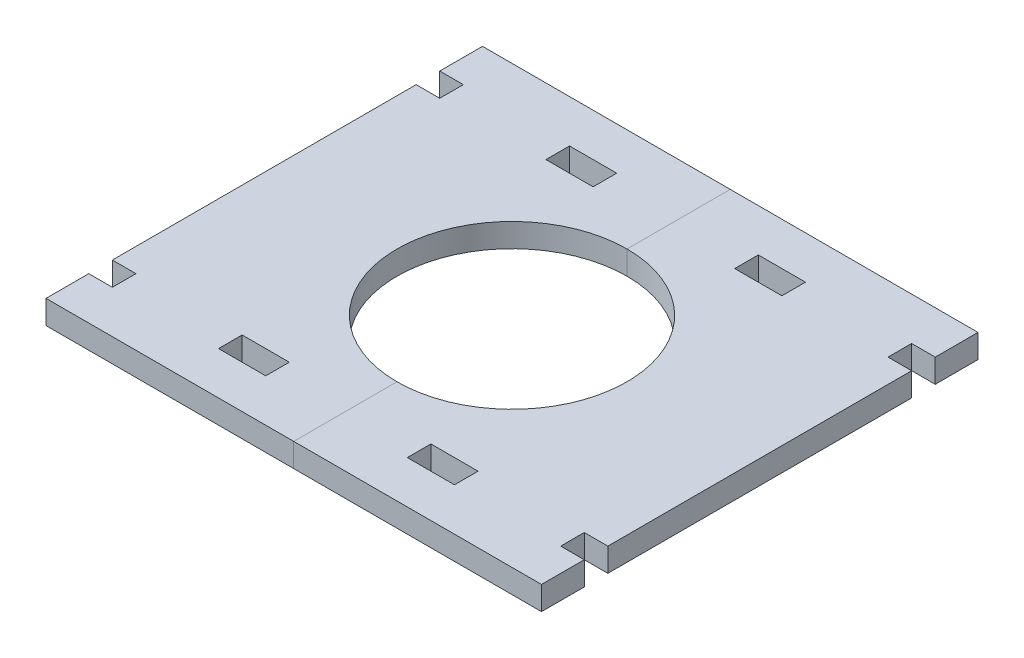
from build123d import *

# Parameters (mm, degrees)
SKETCH2_W               = 84
SKETCH2_H               = 74
SKETCH2_R               = 19.5
BOSS_EXTRUDE1_DEPTH     = 4
CUT_EXTRUDE2_DEPTH      = 57.115951386
CUT_EXTRUDE2_DEPTH_BACK = 57.115951386
SKETCH4_W               = 8
SKETCH4_H               = 4
SKETCH4_W_2             = 4


with BuildPart() as part:
    # Sketch2 → Boss-Extrude1 (new body)
    with BuildSketch(Plane(origin=(0, 0, 0), x_dir=(1, 0, 0), z_dir=(0, 1, 0))):
        Rectangle(SKETCH2_W, SKETCH2_H)
        Circle(SKETCH2_R, mode=Mode.SUBTRACT)
    extrude(amount=BOSS_EXTRUDE1_DEPTH)


with BuildPart() as body_2:
    # Split1: the piece on the far side of the plane
    add(part.part)
    split(bisect_by=Plane(origin=(0, 0, 0), x_dir=(0, 0, 1), z_dir=(1, 0, 0)), keep=Keep.BOTTOM)


with BuildPart() as part_1:
    add(part.part)

    # Split1
    split(bisect_by=Plane(origin=(0, 0, 0), x_dir=(0, 0, 1), z_dir=(1, 0, 0)), keep=Keep.TOP)


with BuildPart() as cut_extrude2_tool:
    # Sketch4 → Cut-Extrude2 (new, two sides: drawn at the far end of the back side and taken through both)
    with BuildSketch(Plane(origin=(0, 4, 0), x_dir=(1, 0, 0), z_dir=(0, 1, 0)).offset(-CUT_EXTRUDE2_DEPTH_BACK)):
        with Locations((-16, -27.75)):
            Rectangle(SKETCH4_W, SKETCH4_H)
        with Locations((-40, -27.75)):
            Rectangle(SKETCH4_W_2, SKETCH4_H)
        with Locations((40, -27.75)):
            Rectangle(SKETCH4_W_2, SKETCH4_H)
        with Locations((16, -27.75)):
            Rectangle(SKETCH4_W, SKETCH4_H)
        with Locations((16, 27.75)):
            Rectangle(SKETCH4_W, SKETCH4_H)
        with Locations((40, 27.75)):
            Rectangle(SKETCH4_W_2, SKETCH4_H)
        with Locations((-40, 27.75)):
            Rectangle(SKETCH4_W_2, SKETCH4_H)
        with Locations((-16, 27.75)):
            Rectangle(SKETCH4_W, SKETCH4_H)
    extrude(amount=CUT_EXTRUDE2_DEPTH + CUT_EXTRUDE2_DEPTH_BACK)


with BuildPart() as part_2:
    add(part_1.part)

    # Cut-Extrude2: cut by cut_extrude2_tool
    add(cut_extrude2_tool.part, mode=Mode.SUBTRACT)


with BuildPart() as body_2_1:
    add(body_2.part)

    # Cut-Extrude2: cut by cut_extrude2_tool
    add(cut_extrude2_tool.part, mode=Mode.SUBTRACT)


solid = Compound([part_2.part, body_2_1.part])
